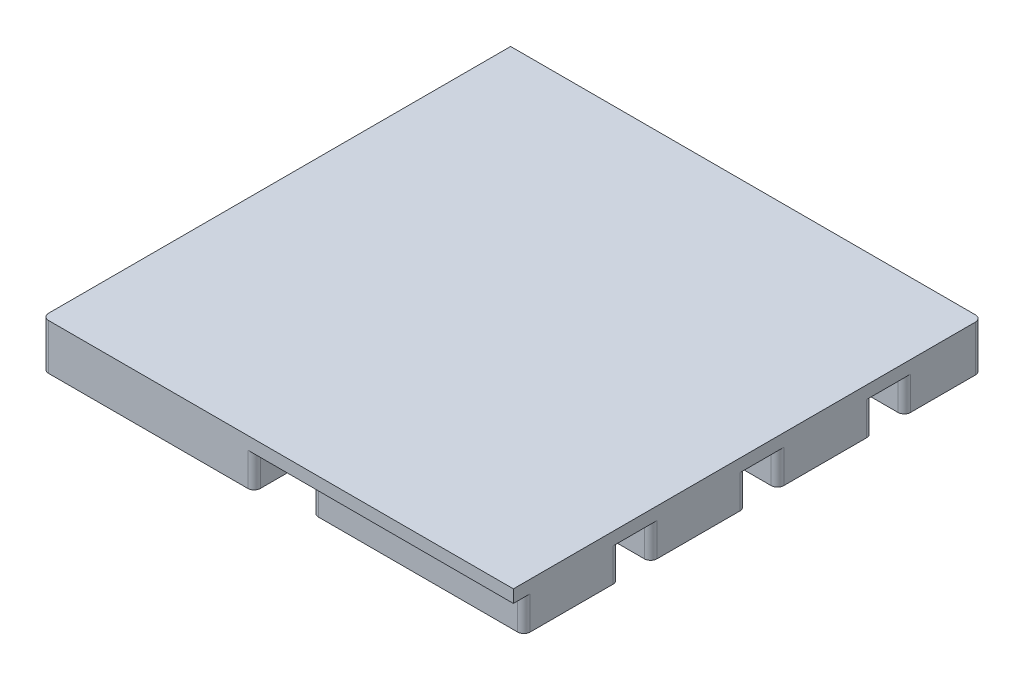
from build123d import *

# Parameters (mm, degrees)
SKETCH2_W           = 149
SKETCH2_H           = 148.13
BOSS_EXTRUDE1_DEPTH = 4
SKETCH3_W           = 67
SKETCH3_H           = 24.5
SKETCH3_H_2         = 30.2
SKETCH3_H_3         = 30.1967
BOSS_EXTRUDE3_DEPTH = 14.5
FILLET1_R           = 2


with BuildPart() as part:
    # Sketch2 → Boss-Extrude1 (new body)
    with BuildSketch(Plane(origin=(0, 0, 0), x_dir=(1, 0, 0), z_dir=(0, 1, 0))):
        with Locations((74.5, 74.065)):
            Rectangle(SKETCH2_W, SKETCH2_H)
    extrude(amount=BOSS_EXTRUDE1_DEPTH)

    # Sketch3 → Boss-Extrude3 (add)
    # profile 1 of 8: a face of its own
    with BuildSketch(Plane(origin=(0, 4, 0), x_dir=(1, 0, 0), z_dir=(0, 1, 0))):
        with Locations((115.5, 135.88)):
            Rectangle(SKETCH3_W, SKETCH3_H)
        with BuildLine():
            ThreePointArc((97, 134.63), (94, 137.63), (97, 140.63))
            Line((97, 140.63), (125, 140.63))
            ThreePointArc((125, 140.63), (128, 137.63), (125, 134.63))
            Line((125, 134.63), (97, 134.63))
        make_face(mode=Mode.SUBTRACT)
    # profile 2 of 8: a face of its own
    with BuildSketch(Plane(origin=(0, 4, 0), x_dir=(1, 0, 0), z_dir=(0, 1, 0))):
        with Locations((115.5, 98.63)):
            Rectangle(SKETCH3_W, SKETCH3_H_2)
        with BuildLine():
            ThreePointArc((97, 94.53), (93.4, 98.13), (97, 101.73))
            Line((97, 101.73), (125, 101.73))
            ThreePointArc((125, 101.73), (128.6, 98.13), (125, 94.53))
            Line((125, 94.53), (97, 94.53))
        make_face(mode=Mode.SUBTRACT)
    # profile 3 of 8: a face of its own
    with BuildSketch(Plane(origin=(0, 4, 0), x_dir=(1, 0, 0), z_dir=(0, 1, 0))):
        with Locations((33.5, 132.5467)):
            Rectangle(SKETCH3_W, SKETCH3_H)
        with BuildLine():
            ThreePointArc((13, 131.9467), (10, 134.9467), (13, 137.9467))
            Line((13, 137.9467), (41, 137.9467))
            ThreePointArc((41, 137.9467), (44, 134.9467), (41, 131.9467))
            Line((41, 131.9467), (13, 131.9467))
        make_face(mode=Mode.SUBTRACT)
    # profile 4 of 8: a face of its own
    with BuildSketch(Plane(origin=(0, 4, 0), x_dir=(1, 0, 0), z_dir=(0, 1, 0))):
        with Locations((115.5, 58.53)):
            Rectangle(SKETCH3_W, SKETCH3_H_2)
        with BuildLine():
            ThreePointArc((97, 54.43), (93.4, 58.03), (97, 61.63))
            Line((97, 61.63), (125, 61.63))
            ThreePointArc((125, 61.63), (127.916973873, 57.71237754), (124.3, 54.43))
            Line((124.3, 54.43), (97, 54.43))
        make_face(mode=Mode.SUBTRACT)
    # profile 5 of 8: a face of its own
    with BuildSketch(Plane(origin=(0, 4, 0), x_dir=(1, 0, 0), z_dir=(0, 1, 0))):
        with Locations((33.5, 95.2967)):
            Rectangle(SKETCH3_W, SKETCH3_H_2)
        with BuildLine():
            ThreePointArc((13, 91.1967), (9.4, 94.7967), (13, 98.3967))
            Line((13, 98.3967), (41, 98.3967))
            ThreePointArc((41, 98.3967), (43.916973873, 94.47907754), (40.3, 91.1967))
            Line((40.3, 91.1967), (13, 91.1967))
        make_face(mode=Mode.SUBTRACT)
    # profile 6 of 8: a face of its own
    with BuildSketch(Plane(origin=(0, 4, 0), x_dir=(1, 0, 0), z_dir=(0, 1, 0))):
        with Locations((115.5, 18.43)):
            Rectangle(SKETCH3_W, SKETCH3_H_2)
        with BuildLine():
            ThreePointArc((97, 14.33), (93.4, 17.93), (97, 21.53))
            Line((97, 21.53), (125, 21.53))
            ThreePointArc((125, 21.53), (127.916973873, 17.61237754), (124.3, 14.33))
            Line((124.3, 14.33), (97, 14.33))
        make_face(mode=Mode.SUBTRACT)
    # profile 7 of 8: a face of its own
    with BuildSketch(Plane(origin=(0, 4, 0), x_dir=(1, 0, 0), z_dir=(0, 1, 0))):
        with Locations((33.5, 55.1967)):
            Rectangle(SKETCH3_W, SKETCH3_H_2)
        with BuildLine():
            ThreePointArc((13, 51.0967), (9.4, 54.6967), (13, 58.2967))
            Line((13, 58.2967), (41, 58.2967))
            ThreePointArc((41, 58.2967), (43.916973873, 54.37907754), (40.3, 51.0967))
            Line((40.3, 51.0967), (13, 51.0967))
        make_face(mode=Mode.SUBTRACT)
    # profile 8 of 8: a face of its own
    with BuildSketch(Plane(origin=(0, 4, 0), x_dir=(1, 0, 0), z_dir=(0, 1, 0))):
        with Locations((33.5, 15.09835)):
            Rectangle(SKETCH3_W, SKETCH3_H_3)
        with BuildLine():
            ThreePointArc((13, 10.9967), (9.4, 14.5967), (13, 18.1967))
            Line((13, 18.1967), (41, 18.1967))
            ThreePointArc((41, 18.1967), (43.916973873, 14.27907754), (40.3, 10.9967))
            Line((40.3, 10.9967), (13, 10.9967))
        make_face(mode=Mode.SUBTRACT)
    extrude(amount=-BOSS_EXTRUDE3_DEPTH)

    # Fillet1
    fillet1_edges = [part.edges().sort_by_distance(p)[0] for p in [
        (149, -5.25, -3.33),
        (149, -5.25, -33.53),
        (82, -5.25, -33.53),
        (82, -5.25, -3.33),
        (67, -5.25, 0),
        (0, -3.25, 0),
        (0, -5.25, -30.1967),
        (67, -5.25, -30.1967),
        (67, -5.25, -40.0967),
        (0, -5.25, -40.0967),
        (149, -5.25, -43.43),
        (82, -5.25, -43.43),
        (82, -5.25, -73.63),
        (67, -5.25, -70.2967),
        (0, -5.25, -70.2967),
        (0, -5.25, -80.1967),
        (82, -5.25, -83.53),
        (67, -5.25, -80.1967),
        (0, -5.25, -110.3967),
        (149, -5.25, -83.53),
        (149, -5.25, -73.63),
        (149, -5.25, -113.73),
        (67, -5.25, -110.3967),
        (82, -5.25, -113.73),
        (0, -5.25, -120.2967),
        (67, -5.25, -120.2967),
        (67, -5.25, -144.7967),
        (0, -5.25, -144.7967),
        (82, -5.25, -123.63),
        (149, -5.25, -123.63),
        (149, -3.25, -148.13),
        (82, -5.25, -148.13),
    ]]
    fillet(fillet1_edges, radius=FILLET1_R)


solid = part.part
